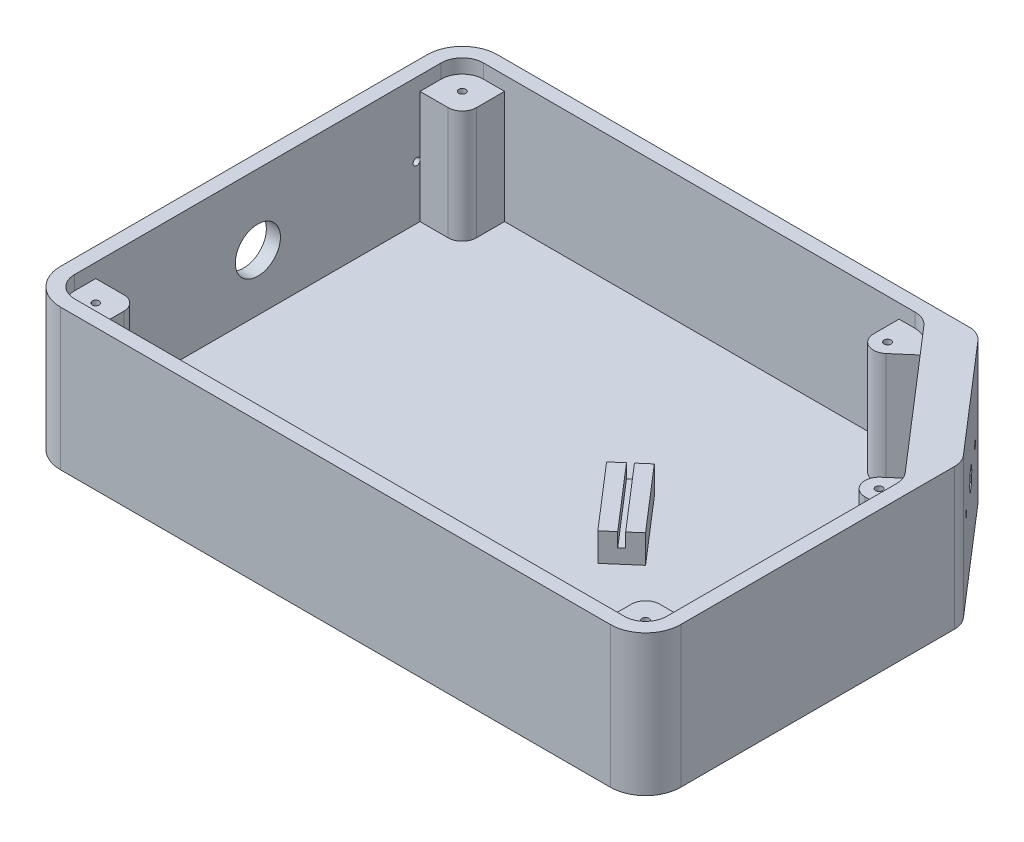
from build123d import *

# Parameters (mm, degrees)
EXTRUDE_2_DEPTH     = 5
EXTRUDE_2_2_DEPTH   = 5
EXTRUDE_3_DEPTH     = 50
EXTRUDE_4_DEPTH     = 10
CUT_EXTRUDE_1_DEPTH = 7.5
SKETCH_9_R          = 1.25
CUT_EXTRUDE_3_DEPTH = 20
SKETCH_10_R         = 8
SKETCH_10_R_2       = 1.25
CUT_EXTRUDE_7_DEPTH = 5
SKETCH_1_9_R        = 1.25
EXTRUDE_5_DEPTH     = 45
SKETCH_14_R         = 1.25
CUT_EXTRUDE_8_DEPTH = 14
EXTRUDE_6_DEPTH     = 15


# Read off the part's stored shape, not the designer's step: 凸台-拉伸4
with BuildPart() as part:
    # 草图1 → 凸台-拉伸2 (new body)
    with BuildSketch(Plane(origin=(0, 0, 0), x_dir=(1, 0, 0), z_dir=(0, 1, 0))):
        with BuildLine():
            Line((56.548408352, 75.246242124), (-83.374180902, 75.246242124))
            Line((-83.374180902, 75.246242124), (-83.374180902, 65.246242124))
            ThreePointArc((-83.374180902, 65.246242124), (-84.838646996, 61.710708218), (-88.374180902, 60.246242124))
            Line((-88.374180902, 60.246242124), (-98.374180902, 60.246242124))
            Line((-98.374180902, 60.246242124), (-98.374180902, -54.753757876))
            Line((-98.374180902, -54.753757876), (-88.374180902, -54.753757876))
            ThreePointArc((-88.374180902, -54.753757876), (-84.838646996, -56.21822397), (-83.374180902, -59.753757876))
            Line((-83.374180902, -59.753757876), (-83.374180902, -69.753757876))
            Line((-83.374180902, -69.753757876), (96.625819098, -69.753757876))
            Line((96.625819098, -69.753757876), (96.625819098, -59.753757876))
            ThreePointArc((96.625819098, -59.753757876), (98.090285193, -56.21822397), (101.625819098, -54.753757876))
            Line((101.625819098, -54.753757876), (111.625819098, -54.753757876))
            Line((111.625819098, -54.753757876), (111.625819098, 14.619924984))
            Line((111.625819098, 14.619924984), (105.067595409, 14.619924984))
            ThreePointArc((105.067595409, 14.619924984), (100.381304866, 17.876743713), (101.799973847, 23.404452606))
            Line((101.799973847, 23.404452606), (106.763929588, 27.690411234))
            Line((106.763929588, 27.690411234), (71.686518841, 68.316728374))
            Line((71.686518841, 68.316728374), (64.816029914, 62.384638559))
            ThreePointArc((64.816029914, 62.384638559), (59.467315828, 61.622843062), (56.548408352, 66.169166182))
            Line((56.548408352, 66.169166182), (56.548408352, 75.246242124))
        make_face()
        Polygon((18.529202454, 9.525154804), (27.612068748, 17.367446554), (47.217798123, -5.33971918), (38.134931829, -13.18201093), align=None, mode=Mode.SUBTRACT)
    extrude(amount=EXTRUDE_2_DEPTH)

    # 草图1<6> → 凸台-拉伸3 (add)
    with BuildSketch(Plane(origin=(0, 0, 0), x_dir=(1, 0, 0), z_dir=(0, 1, 0))):
        with BuildLine():
            Line((116.625819098, 34.900965901), (116.625819098, -62.253757876))
            ThreePointArc((116.625819098, -62.253757876), (112.964653863, -71.092592641), (104.125819098, -74.753757876))
            Line((104.125819098, -74.753757876), (-90.874180902, -74.753757876))
            ThreePointArc((-90.874180902, -74.753757876), (-99.713015666, -71.092592641), (-103.374180902, -62.253757876))
            Line((-103.374180902, -62.253757876), (-103.374180902, 67.746242124))
            ThreePointArc((-103.374180902, 67.746242124), (-99.713015666, 76.585076889), (-90.874180902, 80.246242124))
            Line((-90.874180902, 80.246242124), (76.449603474, 80.246242124))
            ThreePointArc((76.449603474, 80.246242124), (79.57124226, 79.565726803), (82.126394907, 77.647674468))
            Line((82.126394907, 77.647674468), (114.802610532, 39.802398244))
            ThreePointArc((114.802610532, 39.802398244), (116.155254913, 37.515737807), (116.625819098, 34.900965901))
        make_face()
        with BuildLine():
            ThreePointArc((111.625819098, 19.269608073), (111.155254913, 21.88437998), (109.802610532, 24.171040417))
            Line((109.802610532, 24.171040417), (67.947110848, 72.647674468))
            ThreePointArc((67.947110848, 72.647674468), (65.3919582, 74.565726803), (62.270319414, 75.246242124))
            Line((62.270319414, 75.246242124), (-90.874180902, 75.246242124))
            ThreePointArc((-90.874180902, 75.246242124), (-96.17748176, 73.049542983), (-98.374180902, 67.746242124))
            Line((-98.374180902, 67.746242124), (-98.374180902, -62.253757876))
            ThreePointArc((-98.374180902, -62.253757876), (-96.17748176, -67.557058735), (-90.874180902, -69.753757876))
            Line((-90.874180902, -69.753757876), (104.125819098, -69.753757876))
            ThreePointArc((104.125819098, -69.753757876), (109.429119957, -67.557058735), (111.625819098, -62.253757876))
            Line((111.625819098, -62.253757876), (111.625819098, 19.269608073))
        make_face(mode=Mode.SUBTRACT)
    extrude(amount=EXTRUDE_3_DEPTH)

    # 凸台-拉伸4 outline → 凸台-拉伸4 (add)
    with BuildSketch(Plane(origin=(0, 0, 0), x_dir=(1, 0, 0), z_dir=(0, 1, 0))):
        Polygon((43.4332705, -8.607340743), (23.827541125, 14.099824991), (22.313730076, 12.792776366), (41.919459451, -9.914389368), align=None)
    extrude(amount=EXTRUDE_4_DEPTH)

    # 草图6 → 切除-拉伸1 (cut)
    with BuildSketch(Plane(origin=(85.459602861, 0, -73.787185323), x_dir=(-0.6535243124977221, 0, -0.7569055244707755), z_dir=(0.7569055244707754, 0, -0.653524312497722))):
        with BuildLine():
            Line((-22.999642003, 24.2), (-22.999642003, 21.9))
            Line((-22.999642003, 21.9), (-16.799642003, 21.9))
            Line((-16.799642003, 21.9), (-16.799642003, 24.2))
            ThreePointArc((-16.799642003, 24.2), (-15.999642003, 25), (-16.799642003, 25.8))
            Line((-16.799642003, 25.8), (-16.799642003, 27.1))
            Line((-16.799642003, 27.1), (-17.799642003, 28.1))
            Line((-17.799642003, 28.1), (-21.999642003, 28.1))
            Line((-21.999642003, 28.1), (-22.999642003, 27.1))
            Line((-22.999642003, 27.1), (-22.999642003, 25.8))
            ThreePointArc((-22.999642003, 25.8), (-23.799642003, 25), (-22.999642003, 24.2))
        make_face()
    extrude(amount=-CUT_EXTRUDE_1_DEPTH, mode=Mode.SUBTRACT)

    # 草图9 → 切除-拉伸3 (cut)
    with BuildSketch(Plane(origin=(79.782811427, 0, -68.885752979), x_dir=(-0.6535243124977224, 0, -0.7569055244707754), z_dir=(0.7569055244707754, 0, -0.6535243124977224))):
        with Locations((-19.899642003, 25)):
            Circle(SKETCH_9_R)
    extrude(amount=-CUT_EXTRUDE_3_DEPTH, mode=Mode.SUBTRACT)

    # 草图10 → 切除-拉伸7 (cut)
    with BuildSketch(Plane.ZY.offset(103.374180902)):
        with Locations((-2.746242124, 25)):
            Circle(SKETCH_10_R)
        with Locations((-59.046242124, 24)):
            Circle(SKETCH_10_R_2)
        with Locations((53.553757876, 24)):
            Circle(SKETCH_10_R_2)
    extrude(amount=-CUT_EXTRUDE_7_DEPTH, mode=Mode.SUBTRACT)

    # 草图1<9> → 凸台-拉伸5 (add)
    # profile 1 of 5: a face of its own
    with BuildSketch(Plane(origin=(0, 0, 0), x_dir=(1, 0, 0), z_dir=(0, 1, 0))):
        with BuildLine():
            Line((-83.374180902, 75.246242124), (-90.874180902, 75.246242124))
            ThreePointArc((-90.874180902, 75.246242124), (-96.17748176, 73.049542983), (-98.374180902, 67.746242124))
            Line((-98.374180902, 67.746242124), (-98.374180902, 60.246242124))
            Line((-98.374180902, 60.246242124), (-88.374180902, 60.246242124))
            ThreePointArc((-88.374180902, 60.246242124), (-84.838646996, 61.710708218), (-83.374180902, 65.246242124))
            Line((-83.374180902, 65.246242124), (-83.374180902, 75.246242124))
        make_face()
        with Locations(Location((-90.874180902, 67.746242124, 0), (0, 0, 90))):
            Circle(SKETCH_1_9_R, mode=Mode.SUBTRACT)
    # profile 2 of 5: a face of its own
    with BuildSketch(Plane(origin=(0, 0, 0), x_dir=(1, 0, 0), z_dir=(0, 1, 0))):
        with BuildLine():
            Line((-88.374180902, -54.753757876), (-98.374180902, -54.753757876))
            Line((-98.374180902, -54.753757876), (-98.374180902, -62.253757876))
            ThreePointArc((-98.374180902, -62.253757876), (-96.17748176, -67.557058735), (-90.874180902, -69.753757876))
            Line((-90.874180902, -69.753757876), (-83.374180902, -69.753757876))
            Line((-83.374180902, -69.753757876), (-83.374180902, -59.753757876))
            ThreePointArc((-83.374180902, -59.753757876), (-84.838646996, -56.21822397), (-88.374180902, -54.753757876))
        make_face()
        with Locations(Location((-90.874180902, -62.253757876, 0), (0, 0, 90))):
            Circle(SKETCH_1_9_R, mode=Mode.SUBTRACT)
    # profile 3 of 5: a face of its own
    with BuildSketch(Plane(origin=(0, 0, 0), x_dir=(1, 0, 0), z_dir=(0, 1, 0))):
        with BuildLine():
            Line((96.625819098, -59.753757876), (96.625819098, -69.753757876))
            Line((96.625819098, -69.753757876), (104.125819098, -69.753757876))
            ThreePointArc((104.125819098, -69.753757876), (109.429119957, -67.557058735), (111.625819098, -62.253757876))
            Line((111.625819098, -62.253757876), (111.625819098, -54.753757876))
            Line((111.625819098, -54.753757876), (101.625819098, -54.753757876))
            ThreePointArc((101.625819098, -54.753757876), (98.090285193, -56.21822397), (96.625819098, -59.753757876))
        make_face()
        with Locations(Location((104.125819098, -62.253757876, 0), (0, 0, 90))):
            Circle(SKETCH_1_9_R, mode=Mode.SUBTRACT)
    # profile 4 of 5: a face of its own
    with BuildSketch(Plane(origin=(0, 0, 0), x_dir=(1, 0, 0), z_dir=(0, 1, 0))):
        with BuildLine():
            Line((109.802610532, 24.171040417), (106.763929588, 27.690411234))
            Line((106.763929588, 27.690411234), (101.799973847, 23.404452606))
            ThreePointArc((101.799973847, 23.404452606), (100.381304866, 17.876743713), (105.067595409, 14.619924984))
            Line((105.067595409, 14.619924984), (111.625819098, 14.619924984))
            Line((111.625819098, 14.619924984), (111.625819098, 19.269608073))
            ThreePointArc((111.625819098, 19.269608073), (111.155254913, 21.88437998), (109.802610532, 24.171040417))
        make_face()
        with Locations(Location((105.067595409, 19.619924984, 0), (0, 0, 90))):
            Circle(SKETCH_1_9_R, mode=Mode.SUBTRACT)
    # profile 5 of 5: a face of its own
    with BuildSketch(Plane(origin=(0, 0, 0), x_dir=(1, 0, 0), z_dir=(0, 1, 0))):
        with BuildLine():
            Line((62.270319414, 75.246242124), (56.548408352, 75.246242124))
            Line((56.548408352, 75.246242124), (56.548408352, 66.169166182))
            ThreePointArc((56.548408352, 66.169166182), (59.467315828, 61.622843062), (64.816029914, 62.384638559))
            Line((64.816029914, 62.384638559), (71.686518841, 68.316728374))
            Line((71.686518841, 68.316728374), (67.947110848, 72.647674468))
            ThreePointArc((67.947110848, 72.647674468), (65.3919582, 74.565726803), (62.270319414, 75.246242124))
        make_face()
        with Locations(Location((61.548408352, 66.169166182, 0), (0, 0, 90))):
            Circle(SKETCH_1_9_R, mode=Mode.SUBTRACT)
    extrude(amount=EXTRUDE_5_DEPTH)

    # 草图14 → 切除-拉伸8 (cut)
    with BuildSketch(Plane(origin=(74.862925518, 0, -64.637844948), x_dir=(0.6535243124977226, 0, 0.7569055244707751), z_dir=(-0.7569055244707751, 0, 0.6535243124977226))):
        with Locations((34.899642003, 25)):
            Circle(SKETCH_14_R)
        with Locations((4.899642003, 25)):
            Circle(SKETCH_14_R)
    extrude(amount=-CUT_EXTRUDE_8_DEPTH, mode=Mode.SUBTRACT)



with BuildPart() as body_2:
    # 草图1 → Extrude 2 2 (new body)
    with BuildSketch(Plane(origin=(0, 0, 0), x_dir=(1, 0, 0), z_dir=(0, 1, 0))):
        Polygon((40.165648938, -4.822813121), (27.095162688, 10.315297369), (25.581351639, 9.008248744), (38.651837889, -6.129861746), align=None)
    extrude(amount=EXTRUDE_2_2_DEPTH)


with BuildPart() as part_1:
    add(part.part)

    add(body_2.part)  # 凸台-拉伸6 merges body 2
    # 草图1<10> → 凸台-拉伸6 (add)
    with BuildSketch(Plane(origin=(0, 0, 0), x_dir=(1, 0, 0), z_dir=(0, 1, 0))):
        Polygon((23.827541125, 14.099824991), (27.095162688, 10.315297369), (40.165648938, -4.822813121), (43.4332705, -8.607340743), (47.217798123, -5.33971918), (27.612068748, 17.367446554), align=None)
        Polygon((38.651837889, -6.129861746), (25.581351639, 9.008248744), (22.313730076, 12.792776366), (18.529202454, 9.525154804), (38.134931829, -13.18201093), (41.919459451, -9.914389368), align=None)
    extrude(amount=EXTRUDE_6_DEPTH)


solid = part_1.part
